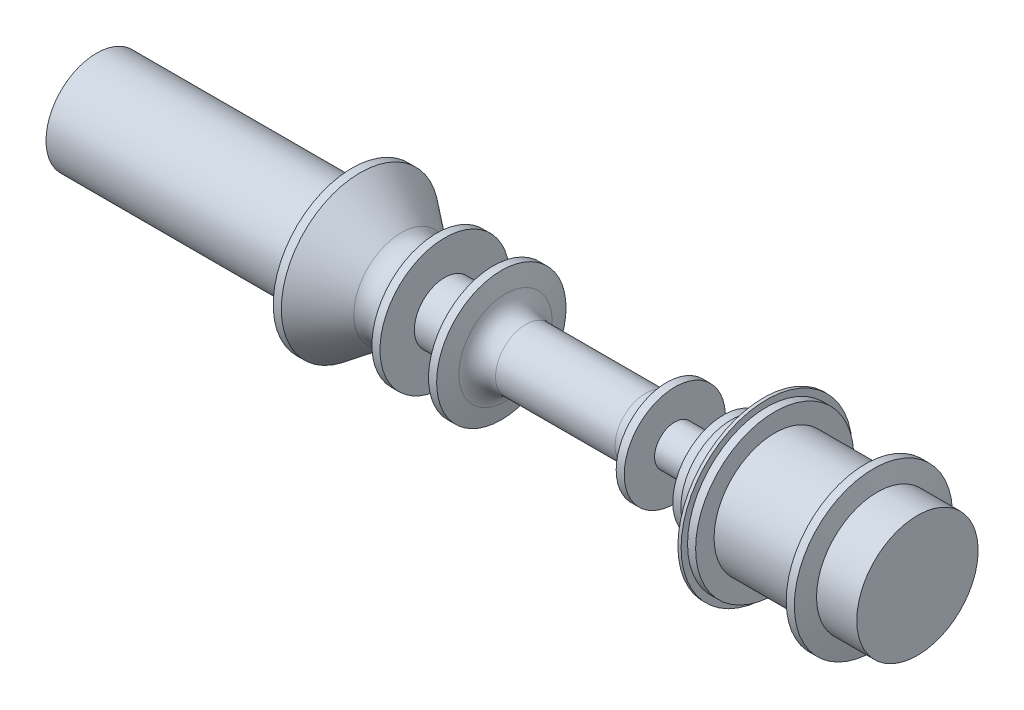
from build123d import *

# Parameters (mm, degrees)
SKETCH5_W           = 12
SKETCH5_H           = 16.095925532
SKETCH10_R          = 12.5
BOSS_EXTRUDE3_DEPTH = 52
SKETCH11_R          = 12.5
CUT_EXTRUDE3_DEPTH  = 109
SCALE1_SCALE        = 1.9329
SKETCH13_R          = 24.16125
BOSS_EXTRUDE4_DEPTH = 5
FILLET1_R           = 10
FILLET2_R           = 10
FILLET4_R           = 5
SCALE2_SCALE        = 1.5
SKETCH15_R          = 36.241875
BOSS_EXTRUDE5_DEPTH = 60


with BuildPart() as part:
    # Sketch1 → Revolve1 (revolve)
    with BuildSketch(Plane(origin=(0, 0, 0), x_dir=(1, 0, 0), z_dir=(0, 1, 0))):
        Polygon((-97.333333333, 12.5), (-57.433333333, 12.5), (-57.433333333, 19.5), (-55.433333333, 19.5), (-39.766666667, 7.5), (-36.533333333, 16), (-34.533333333, 16), (-34.533333333, 7.5), (-22.533333333, 7.5), (-22.533333333, 16), (-20.533333333, 16), (-18.590278059, 7.5), (5.366666667, 7.5), (5.366666667, 0), (-97.333333333, 0), align=None)
    revolve(axis=Axis((99.666666667, 0, 0), (-1, 0, 0)))

    # Sketch2 → Revolve2 (revolve)
    with BuildSketch(Plane.XY, mode=Mode.PRIVATE) as revolve2_sk:
        Polygon((5.366666667, 0), (80.644631229, 0), (80.644631229, 8.695124825), (66.612224209, 8.695124825), (55.795033147, 23.11804624), (52.466666667, 23.11804624), (52.466666667, 12.5), (5.366666667, 12.5), align=None)
    revolve(revolve2_sk.sketch.rotate(Axis((5.366666667, 0, 0), (1, 0, 0)), 90), axis=Axis((5.366666667, 0, 0), (1, 0, 0)))

    # Sketch3 → Cut-Revolve1 (revolve, cut)
    with BuildSketch(Plane.XY, mode=Mode.PRIVATE) as cut_revolve1_sk:
        Polygon((-1.866722484, 7.5), (24.866666667, 7.5), (24.866666667, 12.5), (24.866666667, 26.008660159), (-1.866722484, 26.008660159), align=None)
    revolve(cut_revolve1_sk.sketch.rotate(Axis((-112.967867012, 0, 0), (1, 0, 0)), 270), axis=Axis((-112.967867012, 0, 0), (1, 0, 0)), mode=Mode.SUBTRACT)

    # Sketch4 → Revolve3 (revolve)
    with BuildSketch(Plane.XY, mode=Mode.PRIVATE) as revolve3_sk:
        Polygon((22.366666667, 0), (22.366666667, 12.5), (20.366666667, 12.5), (17.366666667, 0), align=None)
    revolve(revolve3_sk.sketch.rotate(Axis((17.366666667, 0, 0), (1, 0, 0)), 270), axis=Axis((17.366666667, 0, 0), (1, 0, 0)))

    # Sketch5 → Cut-Revolve2 (revolve, cut)
    with BuildSketch(Plane.XY, mode=Mode.PRIVATE) as cut_revolve2_sk:
        with Locations((28.366666667, 13.047962766)):
            Rectangle(SKETCH5_W, SKETCH5_H)
    revolve(cut_revolve2_sk.sketch.rotate(Axis((-109.042031517, 0, 0), (1, 0, 0)), 90), axis=Axis((-109.042031517, 0, 0), (1, 0, 0)), mode=Mode.SUBTRACT)

    # Sketch10 → Boss-Extrude3 (add)
    with BuildSketch(Plane.ZY.offset(-34.366666667)):
        with Locations(Location((0, 0, 0), (0, 0, 180))):
            Circle(SKETCH10_R)
    extrude(amount=-BOSS_EXTRUDE3_DEPTH)

    # Sketch11 → Cut-Extrude3 (cut)
    with BuildSketch(Plane(origin=(22.366666667, 0, 0), x_dir=(0, 0, -1), z_dir=(1, 0, 0))):
        Circle(SKETCH11_R)
    extrude(amount=CUT_EXTRUDE3_DEPTH, mode=Mode.SUBTRACT)


with BuildPart() as body_2:
    # of the pieces the cut leaves, the one that is kept (cut_extrude3_keep)
    add(part.part.solids().sort_by_distance((22.366666667, 0, -12.5))[0])

    # Sketch12 → Revolve6 (revolve)
    with BuildSketch(Plane.XY, mode=Mode.PRIVATE) as revolve6_sk:
        Polygon((22.366666667, 5), (34.366666667, 5), (34.366666667, 12.5), (36.366666667, 12.5), (37.912349785, 5), (45.066666667, 19.558173299), (47.066666667, 19.558173299), (47.066666667, 15), (69.466666667, 15), (69.466666667, 19.558173299), (71.466666667, 19.558173299), (72.406065536, 15), (82.356461942, 15), (82.356461942, 0), (22.366666667, 0), align=None)
    revolve(revolve6_sk.sketch.rotate(Axis((22.366666667, 0, 0), (1, 0, 0)), 90), axis=Axis((22.366666667, 0, 0), (1, 0, 0)))


with BuildPart() as body_2_1:
    # Scale1: scaled about (-3.323692934, 0, 0)
    add(body_2.part.scale(SCALE1_SCALE).moved(Location((3.100673138, 0, 0))))

    # Sketch13 → Boss-Extrude4 (add)
    with BuildSketch(Plane.ZY.offset(185.034926862)):
        with Locations(Location((0, 0, 0), (0, 0, 180))):
            Circle(SKETCH13_R)
    extrude(amount=BOSS_EXTRUDE4_DEPTH)

    # Fillet1
    fillet1_edges = [body_2_1.edges().sort_by_distance(p)[0] for p in [
        (-73.764316862, 0, 14.49675),
    ]]
    fillet(fillet1_edges, radius=FILLET1_R)

    # Fillet2
    # the kernel refuses this fillet: 10 mm, written as the material it adds along each edge
    with BuildSketch(Plane(origin=(40.147923138, 0, 0), x_dir=(0, 0, -1), z_dir=(0, -1, 0))) as fillet2_piece_1:
        with BuildLine():
            CenterArc((14.49675 + FILLET2_R, -FILLET2_R * 0.788396810575), FILLET2_R, 103.495733281, 76.504266719)
            Line((14.49675 + FILLET2_R * 0.766627047525, FILLET2_R * 0.183990491406), (14.49675 + FILLET2_R * 0.761959588475, FILLET2_R * 0.203438237446))
            Line((14.49675 + FILLET2_R * 0.761959588475, FILLET2_R * 0.203438237446), (14.49675 - FILLET2_R * 0.02, FILLET2_R * 0.0157679362115))
            Line((14.49675 - FILLET2_R * 0.02, FILLET2_R * 0.0157679362115), (14.49675 - FILLET2_R * 0.02, -FILLET2_R * 0.788396810575))
            Line((14.49675 - FILLET2_R * 0.02, -FILLET2_R * 0.788396810575), (14.49675, -FILLET2_R * 0.788396810575))
        make_face()
    revolve(axis=Axis((40.147923138, 0, 0), (1, 0, 0)))
    with BuildSketch(Plane(origin=(76.381454038, 0, 0), x_dir=(0, 0, 1), z_dir=(0, 1, 0))) as fillet2_piece_2:
        with BuildLine():
            CenterArc((33.505516614, 0.573905142), FILLET2_R, 116.170866586, 84.693418733)
            Line((29.095020982, 9.548732621), (29.00681107, 9.728229171))
            Line((29.00681107, 9.728229171), (9.576290087, 0.17949655))
            Line((9.576290087, 0.17949655), (9.624130193, -0.195883329))
            ThreePointArc((9.624130193, -0.195883329), (16.872505193, -1.689708779), (23.974364668, -3.058882021))
            Line((23.974364668, -3.058882021), (24.16125, -2.9876509))
        make_face()
    revolve(axis=Axis((76.381454038, 0, 0), (1, 0, 0)))
    with BuildSketch(Plane(origin=(-32.832475321, 0, 0), x_dir=(0, 0, -1), z_dir=(0, 1, 0))) as fillet2_piece_3:
        with BuildLine():
            CenterArc((14.49675 + FILLET2_R, -FILLET2_R * 0.79720034578), FILLET2_R, 102.876270786, 77.123729214)
            Line((14.49675, -FILLET2_R * 0.79720034578), (14.49675 - FILLET2_R * 0.02, -FILLET2_R * 0.79720034578))
            Line((14.49675 - FILLET2_R * 0.02, -FILLET2_R * 0.79720034578), (14.49675 - FILLET2_R * 0.02, FILLET2_R * 0.0159440069156))
            Line((14.49675 - FILLET2_R * 0.02, FILLET2_R * 0.0159440069156), (14.49675 + FILLET2_R * 0.772696675376, FILLET2_R * 0.197150295903))
            Line((14.49675 + FILLET2_R * 0.772696675376, FILLET2_R * 0.197150295903), (14.49675 + FILLET2_R * 0.777153603309, FILLET2_R * 0.177653224497))
        make_face()
    revolve(axis=Axis((-32.832475321, 0, 0), (-1, 0, 0)))

    # Sketch14 → Revolve7 (revolve)
    with BuildSketch(Plane.XY, mode=Mode.PRIVATE) as revolve7_sk:
        Polygon((90.210033138, 0), (90.210033138, 40.883707347), (88.684603111, 40.883707347), (81.69733558, 9.377482841), (81.69733558, 0), align=None)
    revolve(revolve7_sk.sketch.rotate(Axis((81.69733558, 0, 0), (1, 0, 0)), 90), axis=Axis((81.69733558, 0, 0), (1, 0, 0)))

    # Fillet3: read off the stored shape, not the designer's step
    # Fillet3 outline → Fillet3 (revolve)
    with BuildSketch(Plane.YX):
        with BuildLine():
            Line((29.614165238, 86.185309499), (29.095020982, 85.930186659))
            ThreePointArc((29.095020982, 85.930186659), (29.874355922, 86.207955574), (30.673985231, 86.420350223))
            Line((30.673985231, 86.420350223), (29.614165238, 86.420350223))
            Line((29.614165238, 86.420350223), (29.614165238, 86.185309499))
        make_face()
    revolve(axis=Axis((0, 0, 0), (1, 0, 0)))

    # Fillet4
    # the kernel refuses this fillet: 5 mm, written as the material it adds along each edge
    with BuildSketch(Plane(origin=(85.930186659, 0, 0), x_dir=(0, 1, 0), z_dir=(0, 0, -1))) as fillet4_piece_1:
        with BuildLine():
            CenterArc((31.137752518, -4.571000373), FILLET4_R, 109.893555323, 8.371610668)
            ThreePointArc((29.4363836, 0.130631663), (29.265105411, 0.066875579), (29.095020982, 0))
            ThreePointArc((29.095020982, 0), (28.931740857, -0.082101501), (28.769988422, -0.167173266))
        make_face()
    fillet4_piece_1_solid = revolve(axis=Axis((85.930186659, 0, 0), (1, 0, 0)), revolution_arc=90, mode=Mode.PRIVATE)
    with BuildSketch(Plane(origin=(85.930186659, 0, 0), x_dir=(0, 0, 1), z_dir=(0, 1, 0))) as fillet4_piece_2:
        with BuildLine():
            CenterArc((31.137752518, -4.571000373), FILLET4_R, 109.893555323, 8.371610668)
            ThreePointArc((29.4363836, 0.130631663), (29.265105411, 0.066875579), (29.095020982, 0))
            ThreePointArc((29.095020982, 0), (28.931740857, -0.082101501), (28.769988422, -0.167173266))
        make_face()
    fillet4_piece_2_solid = revolve(axis=Axis((85.930186659, 0, 0), (1, 0, 0)), revolution_arc=270, mode=Mode.PRIVATE)
    add([fillet4_piece_1_solid, fillet4_piece_2_solid])


with BuildPart() as body_2_2:
    # Scale2: scaled about (-4.900577652, 0, 5.1e-08)
    add(body_2_1.part.scale(SCALE2_SCALE).moved(Location((2.450288826, 0, -2.6e-08))))

    # Sketch15 → Boss-Extrude5 (add)
    with BuildSketch(Plane.ZY.offset(282.602101447)):
        with Locations(Location((0, 0, 0), (0, 0, 180))):
            Circle(SKETCH15_R)
    extrude(amount=BOSS_EXTRUDE5_DEPTH)


solid = body_2_2.part
